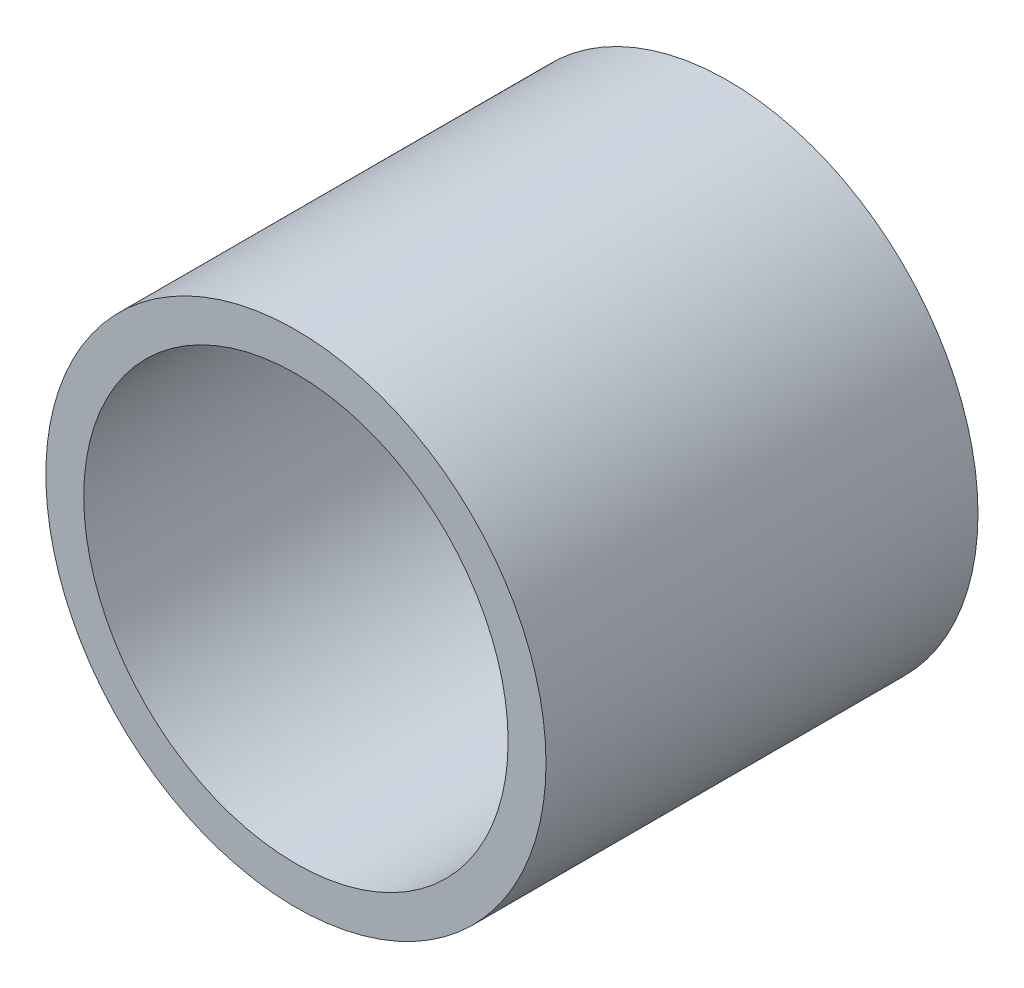
from build123d import *

# Parameters (mm, degrees)
SKETCH1_R           = 3.3
SKETCH1_R_2         = 2.8
BOSS_EXTRUDE1_DEPTH = 5.7


with BuildPart() as part:
    # Sketch1 → Boss-Extrude1 (new body)
    with BuildSketch(Plane.XY):
        Circle(SKETCH1_R)
        Circle(SKETCH1_R_2, mode=Mode.SUBTRACT)
    extrude(amount=BOSS_EXTRUDE1_DEPTH)


solid = part.part
